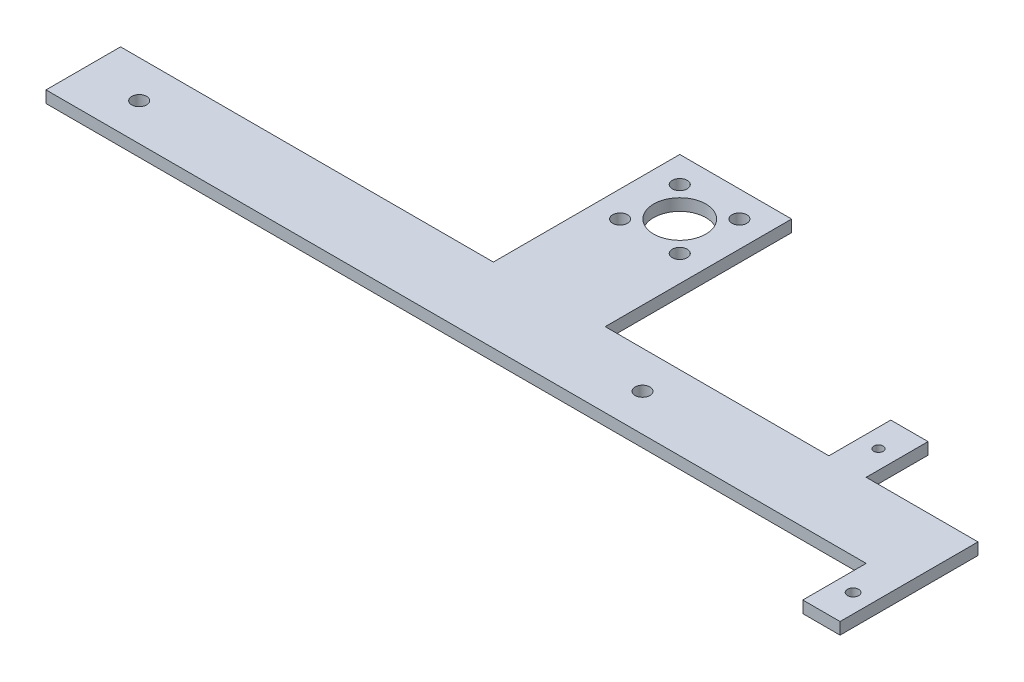
from build123d import *

# Parameters (mm, degrees)
SKETCH1_R           = 1.5
SKETCH1_R_2         = 2
SKETCH1_R_3         = 1.25
BOSS_EXTRUDE1_DEPTH = 3.175


with BuildPart() as part:
    # Sketch1 → Boss-Extrude1 (new body)
    with BuildSketch(Plane(origin=(0, 0, 0), x_dir=(1, 0, 0), z_dir=(0, 1, 0))):
        Polygon((220, -17), (225, -17), (230, -17), (230, 10), (230, 20), (200, 20), (200, 36.6), (195, 36.6), (190, 36.6), (190, 20), (130, 20), (130, 70), (115, 70), (100, 70), (100, 20), (0, 20), (0, 0), (220, 0), align=None)
        with Locations((225, -8.5)):
            Circle(SKETCH1_R, mode=Mode.SUBTRACT)
        with Locations((15, 10)):
            Circle(SKETCH1_R_2, mode=Mode.SUBTRACT)
        with BuildLine():
            ThreePointArc((148, 10), (150, 12), (152, 10))
            ThreePointArc((152, 10), (150, 8), (148, 10))
        make_face(mode=Mode.SUBTRACT)
        with Locations((107, 47)):
            Circle(SKETCH1_R_2, mode=Mode.SUBTRACT)
        with Locations((107, 63)):
            Circle(SKETCH1_R_2, mode=Mode.SUBTRACT)
        with Locations((123, 47)):
            Circle(SKETCH1_R_2, mode=Mode.SUBTRACT)
        with BuildLine():
            ThreePointArc((110.050252532, 59.949747468), (112.321215973, 61.467156728), (115, 62))
            ThreePointArc((115, 62), (117.678784027, 48.532843272), (110.050252532, 59.949747468))
        make_face(mode=Mode.SUBTRACT)
        with Locations((123, 63)):
            Circle(SKETCH1_R_2, mode=Mode.SUBTRACT)
        with Locations((195, 28.3)):
            Circle(SKETCH1_R_3, mode=Mode.SUBTRACT)
    extrude(amount=BOSS_EXTRUDE1_DEPTH)


solid = part.part
